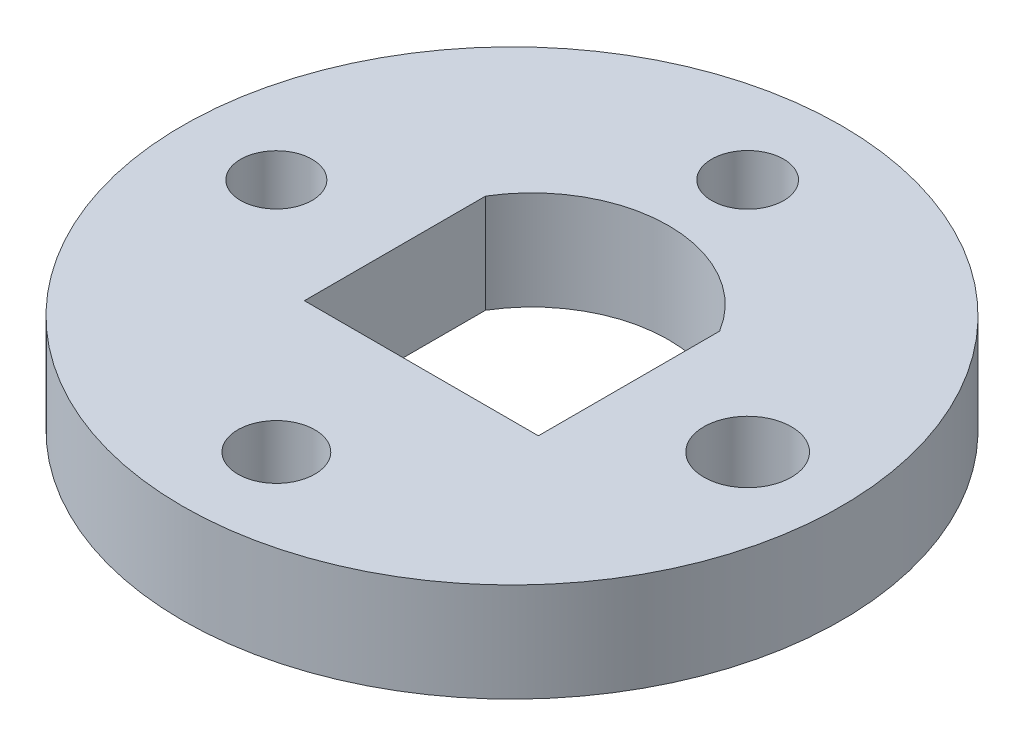
from build123d import *

# Parameters (mm, degrees)
SKETCH1_R           = 25.4
BOSS_EXTRUDE1_DEPTH = 7.62
CUT_EXTRUDE1_DEPTH  = 37.720354029
SKETCH3_R           = 2.75425671
SKETCH3_R_2         = 2.774310661
SKETCH3_R_3         = 3.374548727
SKETCH3_R_4         = 2.967738696
CUT_EXTRUDE2_DEPTH  = 37.720354029


with BuildPart() as part:
    # Sketch1 → Boss-Extrude1 (new body)
    with BuildSketch(Plane(origin=(0, 0, 0), x_dir=(1, 0, 0), z_dir=(0, 1, 0))):
        Circle(SKETCH1_R)
    extrude(amount=BOSS_EXTRUDE1_DEPTH)

    # Sketch2 → Cut-Extrude1 (cut, through all)
    with BuildSketch(Plane(origin=(0, 7.62, 0), x_dir=(1, 0, 0), z_dir=(0, 1, 0))):
        with BuildLine():
            Line((-9.017, -6.985), (9.017, -6.985))
            Line((9.017, -6.985), (9.017, 6.985))
            ThreePointArc((9.017, 6.985), (0, 12.065), (-9.017, 6.985))
            Line((-9.017, 6.985), (-9.017, -6.985))
        make_face()
    extrude(amount=-CUT_EXTRUDE1_DEPTH, mode=Mode.SUBTRACT)

    # Sketch3 → Cut-Extrude2 (cut, through all)
    with BuildSketch(Plane(origin=(0, 7.62, 0), x_dir=(1, 0, 0), z_dir=(0, 1, 0))):
        with Locations((-18.16216899, 0)):
            Circle(SKETCH3_R)
        with Locations((0, 18.16216899)):
            Circle(SKETCH3_R_2)
        with Locations((18.16216899, 0)):
            Circle(SKETCH3_R_3)
        with Locations((0, -18.16216899)):
            Circle(SKETCH3_R_4)
    extrude(amount=-CUT_EXTRUDE2_DEPTH, mode=Mode.SUBTRACT)


solid = part.part
